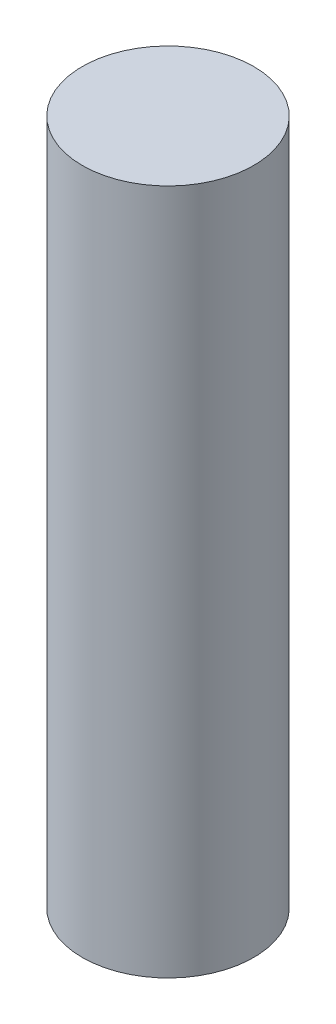
from build123d import *

# Parameters (mm, degrees)
SKETCH1_R           = 5
BOSS_EXTRUDE1_DEPTH = 40


with BuildPart() as part:
    # Sketch1 → Boss-Extrude1 (new body)
    with BuildSketch(Plane(origin=(0, 0, 0), x_dir=(1, 0, 0), z_dir=(0, 1, 0))):
        Circle(SKETCH1_R)
    extrude(amount=BOSS_EXTRUDE1_DEPTH)


solid = part.part
